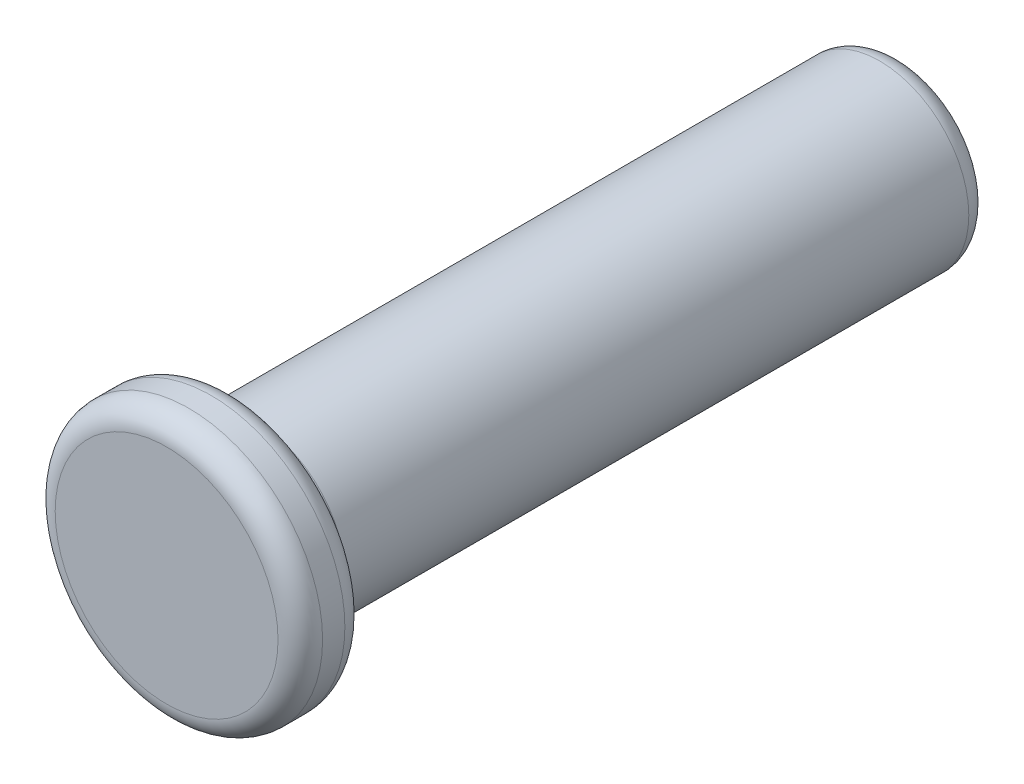
from build123d import *

# Parameters (mm, degrees)
SKETCH1_R           = 4
BOSS_EXTRUDE1_DEPTH = 15
SKETCH2_R           = 6
BOSS_EXTRUDE2_DEPTH = 3
FILLET1_R           = 1


with BuildPart() as part:
    # Sketch1 → Boss-Extrude1 (new, symmetric)
    with BuildSketch(Plane.XY):
        Circle(SKETCH1_R)
    extrude(amount=BOSS_EXTRUDE1_DEPTH, both=True)

    # Sketch2 → Boss-Extrude2 (add)
    with BuildSketch(Plane.XY.offset(15)):
        Circle(SKETCH2_R)
    extrude(amount=BOSS_EXTRUDE2_DEPTH)

    # Fillet1
    fillet1_edges = [part.edges().sort_by_distance(p)[0] for p in [
        (-4, 0, -15),
        (-4, 0, 15),
        (-6, 0, 15),
        (-6, 0, 18),
    ]]
    fillet(fillet1_edges, radius=FILLET1_R - 0.0001)  # a hair under: the kernel refuses the full size


solid = part.part
